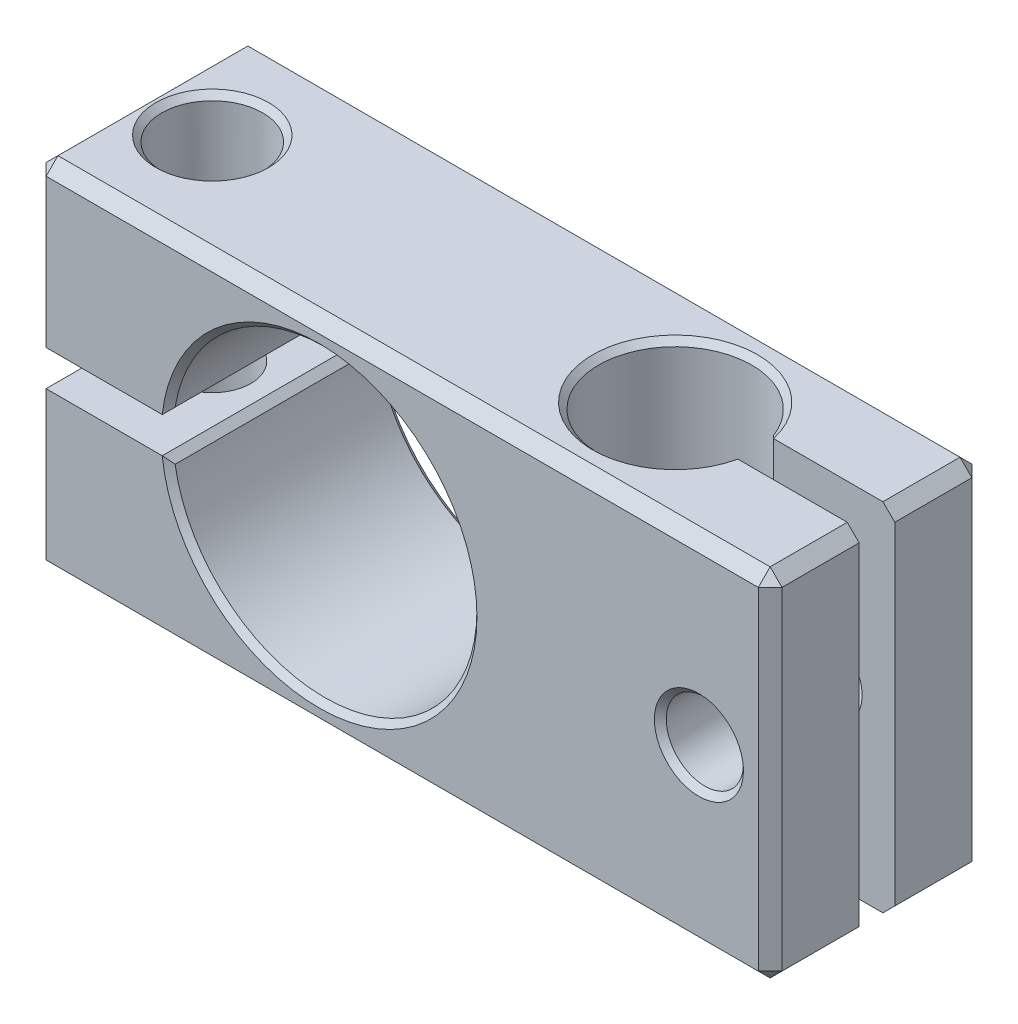
from build123d import *

# Parameters (mm, degrees)
ESQUISSE1_W                  = 62
ESQUISSE1_H                  = 30
BOSS_EXTRU_1_DEPTH           = 18
ENL_V_MAT_EXTRU_1_DEPTH      = 72.189886922
ENL_V_MAT_EXTRU_1_DEPTH_BACK = 72.189886922
ESQUISSE2_R                  = 12.8
ENL_V_MAT_EXTRU_2_DEPTH      = 72.189886922
ENL_V_MAT_EXTRU_2_DEPTH_BACK = 72.189886922
ESQUISSE3_W                  = 15
ESQUISSE3_H                  = 3
ENL_V_MAT_EXTRU_3_DEPTH      = 72.189886922
ENL_V_MAT_EXTRU_3_DEPTH_BACK = 72.189886922
ESQUISSE4_R                  = 6.45
ESQUISSE4_R_2                = 3.25
ENL_V_MAT_EXTRU_4_DEPTH      = 72.189886922
ENL_V_MAT_EXTRU_4_DEPTH_BACK = 72.189886922
ESQUISSE6_W                  = 15
ESQUISSE6_H                  = 3
ENL_V_MAT_EXTRU_5_DEPTH      = 72.189886922
ENL_V_MAT_EXTRU_5_DEPTH_BACK = 72.189886922
ESQUISSE8_R                  = 3.25
ESQUISSE9_R                  = 4.25
ENL_V_MAT_EXTRU_6_DEPTH      = 12.7
ESQUISSE10_R                 = 4.25
ENL_V_MAT_EXTRU_7_DEPTH      = 6
CHANFREIN1_SIZE              = 0.5
CHANFREIN2_SIZE              = 1


with BuildPart() as part:
    # Esquisse1 → Boss.-Extru.1 (new body)
    with BuildSketch(Plane.XY):
        with Locations((31, 15)):
            Rectangle(ESQUISSE1_W, ESQUISSE1_H)
    extrude(amount=BOSS_EXTRU_1_DEPTH)

    # Esquisse2 → Enlèv. mat.-Extru.1 (cut, two sides: drawn at the far end of the back side and taken through both)
    with BuildSketch(Plane.XY.offset(18).offset(-ENL_V_MAT_EXTRU_1_DEPTH_BACK)):
        with Locations((24, 15)):
            Circle(ESQUISSE2_R)
    extrude(amount=ENL_V_MAT_EXTRU_1_DEPTH + ENL_V_MAT_EXTRU_1_DEPTH_BACK, mode=Mode.SUBTRACT)

    # Esquisse3 → Enlèv. mat.-Extru.2 (cut, two sides: drawn at the far end of the back side and taken through both)
    with BuildSketch(Plane.XY.offset(18).offset(-ENL_V_MAT_EXTRU_2_DEPTH_BACK)):
        with Locations((7.5, 15)):
            Rectangle(ESQUISSE3_W, ESQUISSE3_H)
    extrude(amount=ENL_V_MAT_EXTRU_2_DEPTH + ENL_V_MAT_EXTRU_2_DEPTH_BACK, mode=Mode.SUBTRACT)

    # Esquisse4 → Enlèv. mat.-Extru.3 (cut, two sides: drawn at the far end of the back side and taken through both)
    with BuildSketch(Plane.XZ.offset(-ENL_V_MAT_EXTRU_3_DEPTH_BACK)):
        with Locations(Location((45, 9, 0), (0, 0, 270))):
            Circle(ESQUISSE4_R)
        with Locations((6, 9)):
            Circle(ESQUISSE4_R_2)
    extrude(amount=ENL_V_MAT_EXTRU_3_DEPTH + ENL_V_MAT_EXTRU_3_DEPTH_BACK, mode=Mode.SUBTRACT)

    # Esquisse6 → Enlèv. mat.-Extru.4 (cut, two sides: drawn at the far end of the back side and taken through both)
    with BuildSketch(Plane.XZ.offset(-ENL_V_MAT_EXTRU_4_DEPTH_BACK)):
        with Locations((54.5, 9)):
            Rectangle(ESQUISSE6_W, ESQUISSE6_H)
    extrude(amount=ENL_V_MAT_EXTRU_4_DEPTH + ENL_V_MAT_EXTRU_4_DEPTH_BACK, mode=Mode.SUBTRACT)

    # Esquisse8 → Enlèv. mat.-Extru.5 (cut, two sides: drawn at the far end of the back side and taken through both)
    with BuildSketch(Plane.XY.offset(18).offset(-ENL_V_MAT_EXTRU_5_DEPTH_BACK)):
        with Locations((56, 15)):
            Circle(ESQUISSE8_R)
    extrude(amount=ENL_V_MAT_EXTRU_5_DEPTH + ENL_V_MAT_EXTRU_5_DEPTH_BACK, mode=Mode.SUBTRACT)

    # Esquisse9 → Enlèv. mat.-Extru.6 (cut)
    with BuildSketch(Plane(origin=(0, 30, 0), x_dir=(1, 0, 0), z_dir=(0, 1, 0))):
        with Locations(Location((6, -9, 0), (0, 0, 270))):
            Circle(ESQUISSE9_R)
    extrude(amount=-ENL_V_MAT_EXTRU_6_DEPTH, mode=Mode.SUBTRACT)

    # Esquisse10 → Enlèv. mat.-Extru.7 (cut)
    with BuildSketch(Plane(origin=(0, 0, 0), x_dir=(-1, 0, 0), z_dir=(0, 0, -1))):
        with Locations((-56, 15)):
            Circle(ESQUISSE10_R)
    extrude(amount=-ENL_V_MAT_EXTRU_7_DEPTH, mode=Mode.SUBTRACT)

    # Chanfrein1
    # the kernel refuses this chamfer: 0.675653437, 0.570826882, 0.5 mm, written as the material it takes off along each edge
    with BuildSketch(Plane(origin=(6, 0, 9), x_dir=(1, 0, 0), z_dir=(0, 0, -1))) as chanfrein1_piece_1:
        Polygon((3.25 + CHANFREIN1_SIZE, 0), (3.25, -CHANFREIN1_SIZE), (3.25, 0), align=None)
    revolve(axis=Axis((6, 0, 9), (0, -1, 0)), mode=Mode.SUBTRACT)
    with BuildSketch(Plane(origin=(56, 15, 18), x_dir=(1, 0, 0), z_dir=(0, -1, 0))) as chanfrein1_piece_2:
        Polygon((3.25 + CHANFREIN1_SIZE, 0), (3.25, -CHANFREIN1_SIZE), (3.25, 0), align=None)
    revolve(axis=Axis((56, 15, 18), (0, 0, 1)), mode=Mode.SUBTRACT)
    with BuildSketch(Plane(origin=(6, 30, 9), x_dir=(0, 0, 1), z_dir=(-1, 0, 0))) as chanfrein1_piece_3:
        Polygon((4.25 + CHANFREIN1_SIZE, 0), (4.25, -CHANFREIN1_SIZE), (4.25, 0), align=None)
    revolve(axis=Axis((6, 30, 9), (0, 1, 0)), mode=Mode.SUBTRACT)
    with BuildSketch(Plane(origin=(56, 15, 0), x_dir=(-1, 0, 0), z_dir=(0, -1, 0))) as chanfrein1_piece_4:
        Polygon((4.25 + CHANFREIN1_SIZE, 0), (4.25, -CHANFREIN1_SIZE), (4.25, 0), align=None)
    revolve(axis=Axis((56, 15, 0), (0, 0, -1)), mode=Mode.SUBTRACT)
    with BuildSketch(Plane(origin=(11.288194463, 16.5, -1.516273716), x_dir=(0.1399712439743316, 0.990155569019474, 0), z_dir=(0, 0, 1))) as chanfrein1_piece_5:
        with BuildLine():
            Line((0.588107761, 0), (-CHANFREIN1_SIZE * 0.139971243974, CHANFREIN1_SIZE * 0.990155569019))
            Line((-CHANFREIN1_SIZE * 0.139971243974, CHANFREIN1_SIZE * 0.990155569019), (0, 0))
            ThreePointArc((0, 0), (0.303184371, 0.003374833), (0.588107761, 0))
        make_face()
    extrude(amount=21.032547433, mode=Mode.SUBTRACT)
    with BuildSketch(Plane(origin=(11.288194463, 13.5, -1.516273716), x_dir=(-1, 0, 0), z_dir=(0, 0, 1))) as chanfrein1_piece_6:
        with BuildLine():
            Line((CHANFREIN1_SIZE, 0), (-0.082318175, 0.582318175))
            ThreePointArc((-0.082318175, 0.582318175), (-0.039095484, 0.300672073), (0, 0))
            Line((0, 0), (CHANFREIN1_SIZE, 0))
        make_face()
    extrude(amount=21.032547433, mode=Mode.SUBTRACT)
    with BuildSketch(Plane(origin=(51.2731571, 31.928380981, 10.5), x_dir=(1, 0, 0), z_dir=(0, -1, 0))) as chanfrein1_piece_7:
        with BuildLine():
            Line((CHANFREIN1_SIZE, 0), (-0.215649634, 0.715649634))
            ThreePointArc((-0.215649634, 0.715649634), (-0.100904588, 0.372377882), (0, 0))
            Line((0, 0), (CHANFREIN1_SIZE, 0))
        make_face()
    extrude(amount=33.856761963, mode=Mode.SUBTRACT)
    with BuildSketch(Plane(origin=(51.2731571, 31.928380981, 7.5), x_dir=(-0.28851956060345535, 0, -0.9574740012915176), z_dir=(0, -1, 0))) as chanfrein1_piece_8:
        with BuildLine():
            Line((0.747435056, 0), (-CHANFREIN1_SIZE * 0.288519560603, CHANFREIN1_SIZE * 0.957474001292))
            Line((-CHANFREIN1_SIZE * 0.288519560603, CHANFREIN1_SIZE * 0.957474001292), (0, 0))
            ThreePointArc((0, 0), (0.385655089, 0.010824783), (0.747435056, 0))
        make_face()
    extrude(amount=33.856761963, mode=Mode.SUBTRACT)
    # the kernel refuses this chamfer: 0.675653437, 0.570826882, 0.5 mm, written as the material it takes off along each edge
    with BuildSketch(Plane(origin=(24, 15, 18), x_dir=(-0.9980557123023516, 0.06232812479648115, 0), z_dir=(-0.06232812479648115, -0.9980557123023516, 0))) as chanfrein1_2_piece_1:
        Polygon((12.8, CHANFREIN1_SIZE), (12.8 + CHANFREIN1_SIZE, 0), (12.8, 0), align=None)
    revolve(axis=Axis((24, 15, 18), (0, 0, -1)), revolution_arc=352.853090525, mode=Mode.SUBTRACT)
    with BuildSketch(Plane(origin=(24, 15, 0), x_dir=(-0.9980557123023512, -0.06232812479648351, 0), z_dir=(-0.06232812479648351, 0.9980557123023512, 0))) as chanfrein1_2_piece_2:
        Polygon((12.8, CHANFREIN1_SIZE), (12.8 + CHANFREIN1_SIZE, 0), (12.8, 0), align=None)
    revolve(axis=Axis((24, 15, 0), (0, 0, 1)), revolution_arc=352.853090525, mode=Mode.SUBTRACT)
    with BuildSketch(Plane(origin=(45, 30, 9), x_dir=(0.9887286551586735, 0, -0.14971855752751953), z_dir=(0.14971855752751953, 0, 0.9887286551586735))) as chanfrein1_2_piece_3:
        Polygon((6.45 + CHANFREIN1_SIZE, 0), (6.45, -CHANFREIN1_SIZE), (6.45, 0), align=None)
    revolve(axis=Axis((45, 30, 9), (0, 1, 0)), revolution_arc=342.778766173, mode=Mode.SUBTRACT)
    with BuildSketch(Plane(origin=(45, 0, 9), x_dir=(0.9887286551586734, 0, -0.14971855752752006), z_dir=(0.14971855752752006, 0, 0.9887286551586734))) as chanfrein1_2_piece_4:
        Polygon((6.45 + CHANFREIN1_SIZE, 0), (6.45, CHANFREIN1_SIZE), (6.45, 0), align=None)
    revolve(axis=Axis((45, 0, 9), (0, 1, 0)), revolution_arc=342.778766173, mode=Mode.SUBTRACT)

    # Chanfrein2
    chanfrein2_edges = [part.edges().sort_by_distance(p)[0] for p in [
        (62, 15, 18),
        (31, 30, 18),
        (0, 6.75, 0),
        (0, 6.75, 18),
        (0, 13.5, 9),
        (0, 16.5, 9),
        (0, 23.25, 18),
        (31, 30, 0),
        (62, 15, 0),
        (31, 0, 0),
        (62, 30, 3.75),
        (0, 23.25, 0),
        (62, 0, 3.75),
        (31, 0, 18),
        (0, 30, 9),
        (62, 30, 14.25),
        (62, 0, 14.25),
        (0, 0, 9),
    ]]
    chamfer(chanfrein2_edges, length=CHANFREIN2_SIZE)


solid = part.part
